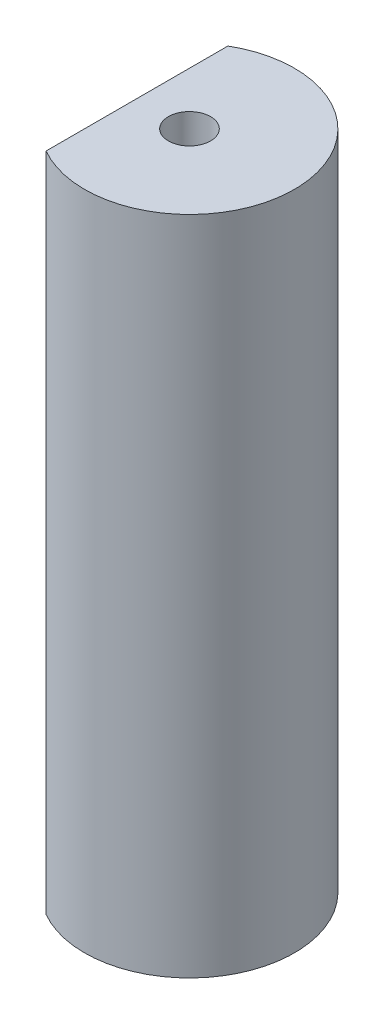
from build123d import *

# Parameters (mm, degrees)
SKETCH1_R                       = 12.7
BOSS_EXTRUDE1_DEPTH             = 80
TAP_DRILL_FOR_1_4_20_TAP1_D     = 5.1054
TAP_DRILL_FOR_1_4_20_TAP1_DEPTH = 10.16
TAP_DRILL_FOR_1_4_20_TAP1_TIP   = 1.533816902
TAP_DRILL_FOR_1_4_20_TAP2_D     = 5.1054
TAP_DRILL_FOR_1_4_20_TAP2_DEPTH = 10.16
TAP_DRILL_FOR_1_4_20_TAP2_TIP   = 1.533816902
CUT_EXTRUDE1_DEPTH              = 82.991341006


with BuildPart() as part:
    # Sketch1 → Boss-Extrude1 (new body)
    with BuildSketch(Plane(origin=(0, 0, 0), x_dir=(1, 0, 0), z_dir=(0, 1, 0))):
        Circle(SKETCH1_R)
    extrude(amount=BOSS_EXTRUDE1_DEPTH)

    # Tap Drill for 1/4-20 Tap1
    with Locations(Plane.XZ):
        with Locations((0, 0)):
            Hole(TAP_DRILL_FOR_1_4_20_TAP1_D / 2, depth=TAP_DRILL_FOR_1_4_20_TAP1_DEPTH)
            with Locations((0, 0, -(TAP_DRILL_FOR_1_4_20_TAP1_DEPTH + TAP_DRILL_FOR_1_4_20_TAP1_TIP / 2))):  # 118° drill point
                Cone(0, TAP_DRILL_FOR_1_4_20_TAP1_D / 2, TAP_DRILL_FOR_1_4_20_TAP1_TIP, mode=Mode.SUBTRACT)

    # Tap Drill for 1/4-20 Tap2
    with Locations(Plane(origin=(0, 80, 0), x_dir=(1, 0, 0), z_dir=(0, 1, 0))):
        with Locations((0, 0)):
            Hole(TAP_DRILL_FOR_1_4_20_TAP2_D / 2, depth=TAP_DRILL_FOR_1_4_20_TAP2_DEPTH)
            with Locations((0, 0, -(TAP_DRILL_FOR_1_4_20_TAP2_DEPTH + TAP_DRILL_FOR_1_4_20_TAP2_TIP / 2))):  # 118° drill point
                Cone(0, TAP_DRILL_FOR_1_4_20_TAP2_D / 2, TAP_DRILL_FOR_1_4_20_TAP2_TIP, mode=Mode.SUBTRACT)

    # Sketch6 → Cut-Extrude1 (cut, through all)
    with BuildSketch(Plane(origin=(0, 80, 0), x_dir=(1, 0, 0), z_dir=(0, 1, 0))):
        with BuildLine():
            Line((-6.35, 10.998522628), (-6.35, -10.998522628))
            ThreePointArc((-6.35, -10.998522628), (-12.7, 0), (-6.35, 10.998522628))
        make_face()
    extrude(amount=-CUT_EXTRUDE1_DEPTH, mode=Mode.SUBTRACT)


solid = part.part
